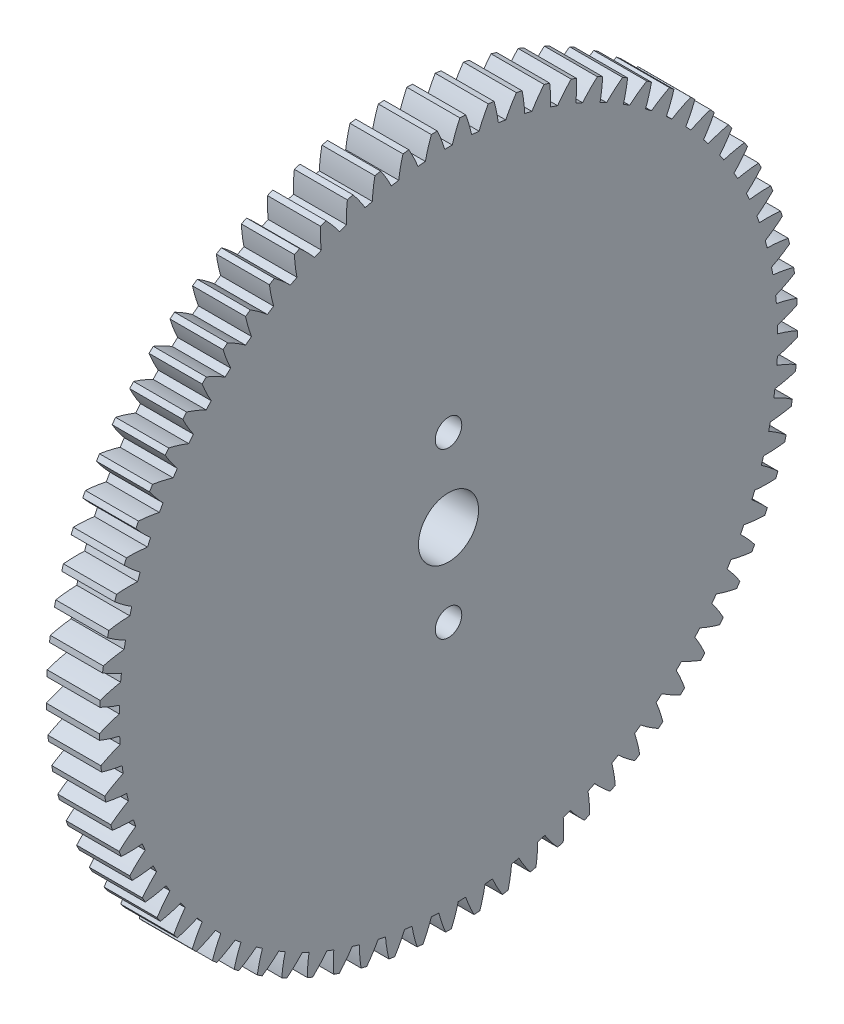
from build123d import *

# Parameters (mm, degrees)
BASPROSKE_W     = 2
BASPROSKE_H     = 39.5
TOOTHCUT_DEPTH  = 56.897227123
TEETHCUTS_COUNT = 77
TEETHCUTS_ANGLE = 355.324675325
BORSKE_R        = 3.4
BORSKE_R_2      = 1.5
BORE_DEPTH      = 50.0000508
SCALE1_SCALE_X  = 3
SCALE1_SCALE_Y  = 1
SCALE1_SCALE_Z  = 1


with BuildPart() as part:
    # BasProSke → Base-Revolve (revolve)
    with BuildSketch(Plane(origin=(0, 0, 0), x_dir=(1, 0, 0), z_dir=(0, 1, 0))):
        with Locations((1, 19.75)):
            Rectangle(BASPROSKE_W, BASPROSKE_H)
    revolve(axis=Axis((-10, 0, 0), (1, 0, 0)))

    # TooCutSke → ToothCut (cut, through all)
    with BuildSketch(Plane(origin=(0, 0, 0), x_dir=(0, 0, -1), z_dir=(1, 0, 0))):
        with BuildLine():
            ThreePointArc((0.421689506, 37.246612986), (0, 37.249), (-0.421689506, 37.246612986))
            ThreePointArc((-0.421689506, 37.246612986), (-0.813577504, 38.392577583), (-1.294307305, 39.504202482))
            ThreePointArc((-1.294307305, 39.504202482), (0, 39.5254), (1.294307305, 39.504202482))
            ThreePointArc((1.294307305, 39.504202482), (0.813577504, 38.392577583), (0.421689506, 37.246612986))
        make_face()
    toothcut = extrude(amount=TOOTHCUT_DEPTH, mode=Mode.SUBTRACT)

    # TeethCuts: ToothCut ×77 about axis
    teethcuts_axis = Axis((-10, 0, 0), (1, 0, 0))
    for i in range(1, TEETHCUTS_COUNT):
        add(toothcut.rotate(teethcuts_axis, i * TEETHCUTS_ANGLE / (TEETHCUTS_COUNT - 1)), mode=Mode.SUBTRACT)

    # BorSke → Bore (cut, symmetric)
    with BuildSketch(Plane(origin=(0, 0, 0), x_dir=(0, 0, -1), z_dir=(1, 0, 0))):
        Circle(BORSKE_R)
        with Locations((0, -9.3)):
            Circle(BORSKE_R_2)
        with Locations((0, 9.3)):
            Circle(BORSKE_R_2)
    extrude(amount=BORE_DEPTH, both=True, mode=Mode.SUBTRACT)


with BuildPart() as part_1:
    # Scale1: scaled about (1, 0, 0)
    add(part.part.scale((SCALE1_SCALE_X, SCALE1_SCALE_Y, SCALE1_SCALE_Z), about=(1, 0, 0)))


solid = part_1.part
